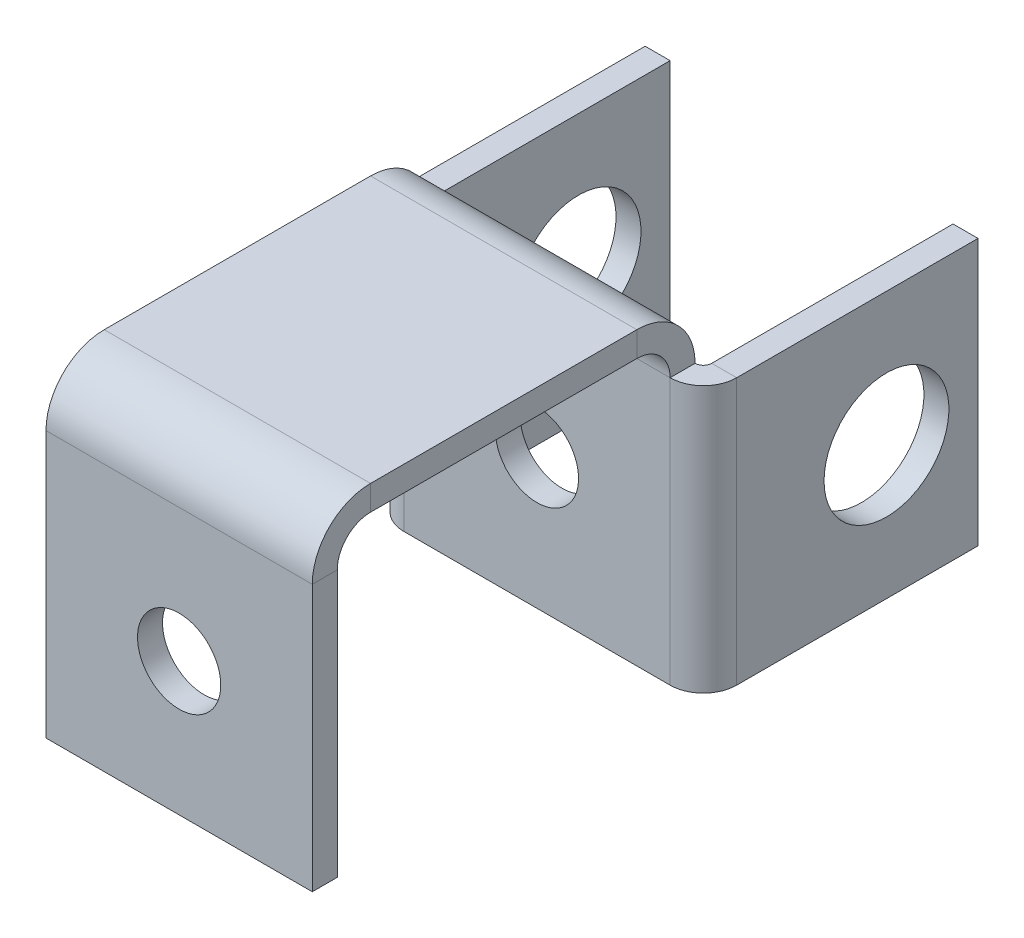
from build123d import *

# Parameters (mm, degrees)
SKETCH1_W                      = 32
SKETCH1_H                      = 32
BASE_FLANGE1_DEPTH             = 3
KENAR_FLAN_1_DEPTH             = 32
KENAR_FLAN_2_DEPTH             = 32
KENAR_FLAN_3_DEPTH             = 32
KENAR_FLAN_4_DEPTH             = 32
SKETCH20_R                     = 5
CUT_EXTRUDE1_DEPTH             = 82.884064384
CUT_EXTRUDE2_REACH             = 65.071
SKETCH21_R                     = 7.5
CUT_EXTRUDE2_DIRECTION_2_DEPTH = 64.071388125


# Sheet-metal steps are written as plain solids
with BuildPart() as part:
    # Sketch1 → Base-Flange1 (new body)
    with BuildSketch(Plane.XY):
        Rectangle(SKETCH1_W, SKETCH1_H)
    extrude(amount=-BASE_FLANGE1_DEPTH)

    # Kenar-Flanş1 section (across the edge) → Kenar-Flanş1 (add)
    with BuildSketch(Plane(origin=(16, 20, 0), x_dir=(0, -1, 0), z_dir=(-1, 0, 0))):
        with BuildLine():
            Line((-3, 4), (-3, 36))
            Line((-3, 36), (0, 36))
            Line((0, 36), (0, 4))
            ThreePointArc((0, 4), (1.171572875, 1.171572875), (4, 0))
            Line((4, 0), (4, -3))
            ThreePointArc((4, -3), (-0.949747468, -0.949747468), (-3, 4))
        make_face()
    extrude(amount=KENAR_FLAN_1_DEPTH)

    # Kenar-Flanş2 section (across the edge) → Kenar-Flanş2 (add)
    with BuildSketch(Plane(origin=(16, 20, 40), x_dir=(0, 0, -1), z_dir=(-1, 0, 0))):
        with BuildLine():
            Line((-3, 4), (-3, 36))
            Line((-3, 36), (0, 36))
            Line((0, 36), (0, 4))
            ThreePointArc((0, 4), (1.171572875, 1.171572875), (4, 0))
            Line((4, 0), (4, -3))
            ThreePointArc((4, -3), (-0.949747468, -0.949747468), (-3, 4))
        make_face()
    extrude(amount=KENAR_FLAN_2_DEPTH)

    # Kenar-Flanş3 section (across the edge) → Kenar-Flanş3 (add)
    with BuildSketch(Plane(origin=(-17, -16, -3), x_dir=(1, 0, 0), z_dir=(0, 1, 0))):
        with BuildLine():
            Line((-3, 1), (-3, 30))
            Line((-3, 30), (0, 30))
            Line((0, 30), (0, 1))
            ThreePointArc((0, 1), (0.292893219, 0.292893219), (1, 0))
            Line((1, 0), (1, -3))
            ThreePointArc((1, -3), (-1.828427125, -1.828427125), (-3, 1))
        make_face()
    extrude(amount=KENAR_FLAN_3_DEPTH)

    # Kenar-Flanş4 section (across the edge) → Kenar-Flanş4 (add)
    with BuildSketch(Plane(origin=(17, 16, -3), x_dir=(-1, 0, 0), z_dir=(0, -1, 0))):
        with BuildLine():
            Line((-3, 1), (-3, 30))
            Line((-3, 30), (0, 30))
            Line((0, 30), (0, 1))
            ThreePointArc((0, 1), (0.292893219, 0.292893219), (1, 0))
            Line((1, 0), (1, -3))
            ThreePointArc((1, -3), (-1.828427125, -1.828427125), (-3, 1))
        make_face()
    extrude(amount=KENAR_FLAN_4_DEPTH)

    # Sketch20 → Cut-Extrude1 (cut, through all)
    with BuildSketch(Plane.XY.offset(43)):
        Circle(SKETCH20_R)
    extrude(amount=-CUT_EXTRUDE1_DEPTH, mode=Mode.SUBTRACT)

    # Cut-Extrude2: up to this face of the body (flat: up to its plane)
    cut_extrude2_end = Plane(part.part.faces().sort_by_distance((20, 0, -18.5))[0])
    # Sketch21 → Cut-Extrude2 (cut, up to the picked face)
    with BuildSketch(Plane.ZY.offset(20), mode=Mode.PRIVATE) as cut_extrude2_sk1:
        with Locations((-22, 0)):
            Circle(SKETCH21_R)
    cut_extrude2_tool1 = split(extrude(cut_extrude2_sk1.sketch, amount=-CUT_EXTRUDE2_REACH, mode=Mode.PRIVATE), bisect_by=cut_extrude2_end, keep=Keep.BOTH, mode=Mode.PRIVATE)
    add(cut_extrude2_tool1.solids().sort_by(Axis((-20, 0, -22), (1, 0, 0)))[0], mode=Mode.SUBTRACT)

    # Sketch21 → Cut-Extrude2 direction 2 (cut)
    with BuildSketch(Plane.ZY.offset(20)):
        with Locations((-22, 0)):
            Circle(SKETCH21_R)
    extrude(amount=CUT_EXTRUDE2_DIRECTION_2_DEPTH, mode=Mode.SUBTRACT)


solid = part.part
